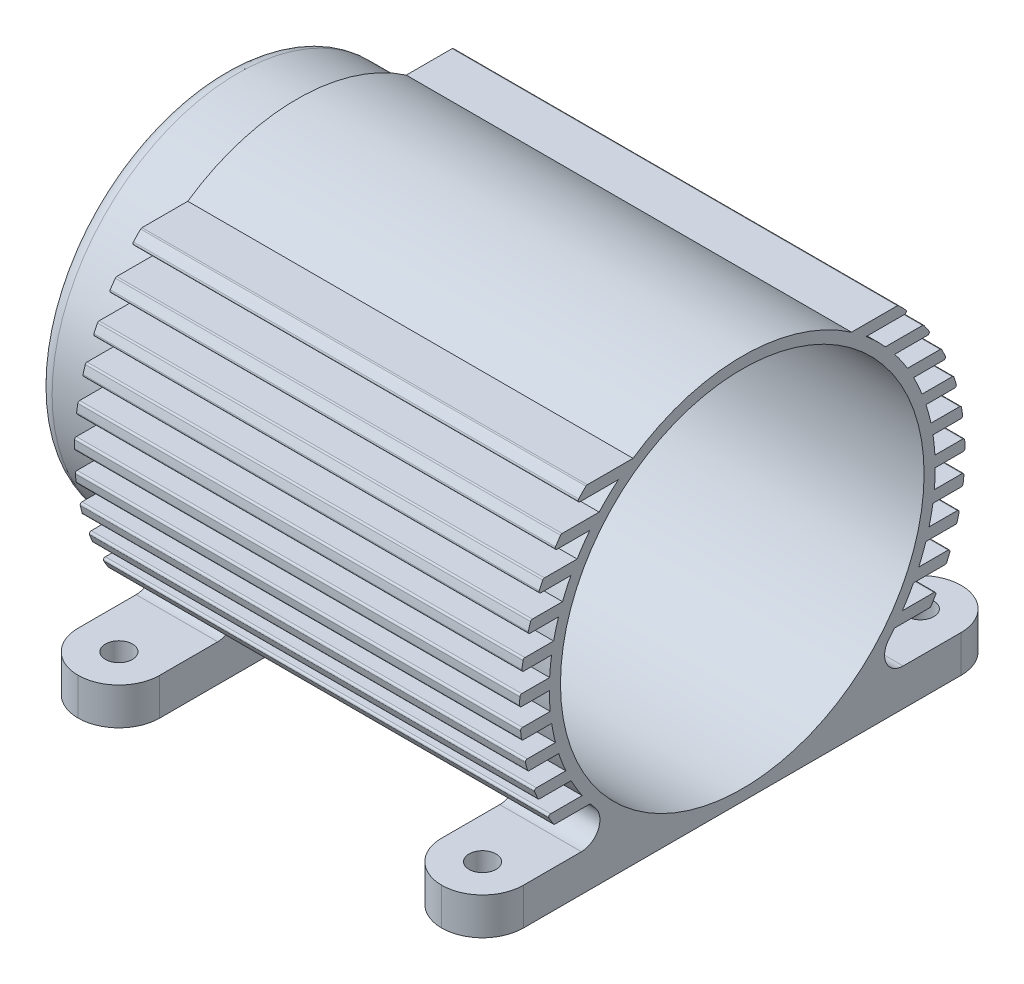
from build123d import *
from build123d.topology import SkipClean

# Parameters (mm, degrees)
BOSS_EXTRUDE1_START  = -558.8
BOSS_EXTRUDE1_DEPTH  = 558.8
FILLET1_R            = 279.4
SKETCH8_R            = 92.224359794
CUT_EXTRUDE1_DEPTH   = 558.8
FILLET1_OF_MIRROR1_R = 279.4
FILLET2_R            = 127
BOSS_EXTRUDE2_DEPTH  = 3048


with BuildPart() as part:
    # Sketch2 → Revolve1 (revolve)
    with BuildSketch(Plane.XY, mode=Mode.PRIVATE) as revolve1_sk:
        with BuildLine():
            Line((0, 393.7), (0, 1168.4))
            ThreePointArc((0, 1168.4), (29.757951031, 1240.242048969), (101.6, 1270))
            Line((101.6, 1270), (508, 1270))
            Line((508, 1270), (508, 1320.8))
            Line((508, 1320.8), (3556, 1320.8))
            Line((3556, 1320.8), (3556, 1244.6))
            Line((3556, 1244.6), (584.2, 1244.6))
            Line((584.2, 1244.6), (584.2, 1193.8))
            Line((584.2, 1193.8), (101.6, 1193.8))
            ThreePointArc((101.6, 1193.8), (83.639487758, 1186.360512242), (76.2, 1168.4))
            Line((76.2, 1168.4), (76.2, 393.7))
            Line((76.2, 393.7), (0, 393.7))
        make_face()
    revolve(revolve1_sk.sketch.rotate(Axis((0, 0, 0), (1, 0, 0)), 90), axis=Axis((0, 0, 0), (1, 0, 0)))

    # Sketch5 → Boss-Extrude1 (add)
    with SkipClean():  # the faces are left unmerged after this step: merging them gives an invalid solid
        with BuildSketch(Plane(origin=(3556, 0, 0), x_dir=(0, 0, -1), z_dir=(1, 0, 0)).offset(BOSS_EXTRUDE1_START)):
            with BuildLine():
                Line((-641.067016777, -1066.8), (-1778, -1066.8))
                Line((-1778, -1066.8), (-1778, -1320.8))
                Line((-1778, -1320.8), (1778, -1320.8))
                Line((1778, -1320.8), (1778, -1066.8))
                Line((1778, -1066.8), (641.067016777, -1066.8))
                ThreePointArc((641.067016777, -1066.8), (0, -1244.6), (-641.067016777, -1066.8))
            make_face()
        boss_extrude1 = extrude(amount=BOSS_EXTRUDE1_DEPTH)
    add(part.part.scale(1), mode=Mode.REPLACE)  # the faces are merged on a copy

    # Fillet1
    fillet1_edges = [part.edges().sort_by_distance(p)[0] for p in [
        (2997.2, -1193.8, 1778),
        (3556, -1193.8, 1778),
        (2997.2, -1193.8, -1778),
        (3556, -1193.8, -1778),
    ]]
    fillet(fillet1_edges, radius=FILLET1_R - 0.0001)  # a hair under: the kernel refuses the full size

    # Sketch8 → Cut-Extrude1 (cut)
    with BuildSketch(Plane(origin=(0, -1066.8, 0), x_dir=(1, 0, 0), z_dir=(0, 1, 0))):
        with Locations(Location((3276.6, -1498.6, 0), (0, 0, 270))):
            Circle(SKETCH8_R)
        with Locations(Location((3276.6, 1498.6, 0), (0, 0, 90))):
            Circle(SKETCH8_R)
    cut_extrude1 = extrude(amount=-CUT_EXTRUDE1_DEPTH, mode=Mode.SUBTRACT)

    # Mirror1: Boss-Extrude1, Cut-Extrude1 across plane
    add(boss_extrude1.mirror(Plane.ZY.offset(-2032)))
    add(cut_extrude1.mirror(Plane.ZY.offset(-2032)), mode=Mode.SUBTRACT)

    # Fillet1 of Mirror1
    fillet1_of_mirror1_edges = [part.edges().sort_by_distance(p)[0] for p in [
        (1066.8, -1193.8, 1778),
        (508, -1193.8, 1778),
        (1066.8, -1193.8, -1778),
        (508, -1193.8, -1778),
    ]]
    fillet(fillet1_of_mirror1_edges, radius=FILLET1_OF_MIRROR1_R - 0.0001)  # a hair under: the kernel refuses the full size

    # Fillet2
    fillet2_edges = [part.edges().sort_by_distance(p)[0] for p in [
        (3276.6, -1066.8, 778.749253611),
        (3276.6, -1066.8, -778.749253611),
        (787.4, -1066.8, -778.749253611),
        (787.4, -1066.8, 778.749253611),
    ]]
    fillet(fillet2_edges, radius=FILLET2_R)

    # Sketch9 → Boss-Extrude2 (add)
    with BuildSketch(Plane(origin=(3556, 0, 0), x_dir=(0, 0, -1), z_dir=(1, 0, 0))):
        with BuildLine():
            Line((1061.282386538, 1088.66811571), (747.873233801, 1088.66811571))
            ThreePointArc((747.873233801, 1088.66811571), (798.939026584, 1051.764741661), (848.186863062, 1012.46811571))
            Line((848.186863062, 1012.46811571), (1110.431458727, 1012.46811571))
            ThreePointArc((1110.431458727, 1012.46811571), (1122.065432641, 1020.074919173), (1119.762815523, 1033.782973825))
            ThreePointArc((1119.762815523, 1033.782973825), (1095.281300305, 1059.686214501), (1070.20072592, 1085.009864582))
            ThreePointArc((1070.20072592, 1085.009864582), (1066.102126641, 1087.718013809), (1061.282386538, 1088.66811571))
        make_face()
        with BuildLine():
            Line((1233.53895303, 885.860547298), (979.675319042, 885.860547298))
            ThreePointArc((979.675319042, 885.860547298), (1012.321699588, 848.361607184), (1043.533630579, 809.660547298))
            Line((1043.533630579, 809.660547298), (1267.971143302, 809.660547298))
            ThreePointArc((1267.971143302, 809.660547298), (1279.130321789, 816.297319156), (1278.626362994, 829.271140132))
            ThreePointArc((1278.626362994, 829.271140132), (1261.52564349, 855.060846265), (1243.904826585, 880.498030889))
            ThreePointArc((1243.904826585, 880.498030889), (1239.374360402, 884.440530489), (1233.53895303, 885.860547298))
        make_face()
        with BuildLine():
            Line((1354.494213239, 683.052978886), (1130.465067145, 683.052978886))
            ThreePointArc((1130.465067145, 683.052978886), (1152.429237397, 645.305735906), (1173.133454479, 606.852978886))
            Line((1173.133454479, 606.852978886), (1378.4708181, 606.852978886))
            ThreePointArc((1378.4708181, 606.852978886), (1389.134081201, 612.654803762), (1390.054606488, 624.759306439))
            ThreePointArc((1390.054606488, 624.759306439), (1378.203591164, 650.485096911), (1365.876517552, 675.986197196))
            ThreePointArc((1365.876517552, 675.986197196), (1361.19302386, 681.142600578), (1354.494213239, 683.052978886))
        make_face()
        with BuildLine():
            Line((1437.160039503, 480.245410473), (1230.39708457, 480.245410473))
            ThreePointArc((1230.39708457, 480.245410473), (1244.522672917, 442.352751315), (1257.481588841, 404.045410473))
            Line((1257.481588841, 404.045410473), (1452.704702563, 404.045410473))
            ThreePointArc((1452.704702563, 404.045410473), (1462.847833019, 409.102969465), (1464.912305106, 420.247472746))
            ThreePointArc((1464.912305106, 420.247472746), (1457.299767723, 445.929800522), (1449.237014625, 471.474363503))
            ThreePointArc((1449.237014625, 471.474363503), (1444.623024715, 477.821297381), (1437.160039503, 480.245410473))
        make_face()
        with BuildLine():
            Line((1487.931975925, 277.437842061), (1291.332987185, 277.437842061))
            ThreePointArc((1291.332987185, 277.437842061), (1298.915205213, 239.44086883), (1305.379627129, 201.237842061))
            Line((1305.379627129, 201.237842061), (1496.080976998, 201.237842061))
            ThreePointArc((1496.080976998, 201.237842061), (1505.67581993, 205.617446091), (1508.653086048, 215.735639053))
            ThreePointArc((1508.653086048, 215.735639053), (1504.762352566, 241.384055606), (1500.435605975, 266.96252981))
            ThreePointArc((1500.435605975, 266.96252981), (1496.087846988, 274.47292127), (1487.931975925, 277.437842061))
        make_face()
        with BuildLine():
            Line((1510.030572937, 74.630273649), (1318.689865835, 74.630273649))
            ThreePointArc((1318.689865835, 74.630273649), (1320.294310722, 36.545493231), (1320.799067216, -1.569726351))
            Line((1320.799067216, -1.569726351), (1511.259013872, -1.569726351))
            ThreePointArc((1511.259013872, -1.569726351), (1520.272277785, 2.183147092), (1523.95866945, 11.22380536))
            ThreePointArc((1523.95866945, 11.22380536), (1523.554604641, 36.842457519), (1522.719905483, 62.450696117))
            ThreePointArc((1522.719905483, 62.450696117), (1518.824907326, 71.092679592), (1510.030572937, 74.630273649))
        make_face()
        with BuildLine():
            Line((1504.71966752, -128.177294763), (1314.565791852, -128.177294763))
            ThreePointArc((1314.565791852, -128.177294763), (1310.282833829, -166.347634107), (1304.891781484, -204.377294763))
            Line((1304.891781484, -204.377294763), (1499.095562222, -204.377294763))
            ThreePointArc((1499.095562222, -204.377294763), (1507.487036576, -201.210036141), (1511.693003921, -193.288028333))
            ThreePointArc((1511.693003921, -193.288028333), (1514.745256844, -167.698559532), (1517.364370608, -142.061137576))
            ThreePointArc((1517.364370608, -142.061137576), (1514.109151098, -132.325827162), (1504.71966752, -128.177294763))
        make_face()
        with BuildLine():
            Line((1471.702553108, -330.984863176), (1278.656193177, -330.984863176))
            ThreePointArc((1278.656193177, -330.984863176), (1268.134823471, -369.251553145), (1256.46851421, -407.184863176))
            Line((1256.46851421, -407.184863176), (1458.90691366, -407.184863176))
            ThreePointArc((1458.90691366, -407.184863176), (1466.62667773, -404.569269093), (1471.166635624, -397.799862026))
            ThreePointArc((1471.166635624, -397.799862026), (1477.84019716, -372.242329215), (1484.069801453, -346.572971269))
            ThreePointArc((1484.069801453, -346.572971269), (1481.65164786, -335.791479009), (1471.702553108, -330.984863176))
        make_face()
        with BuildLine():
            Line((1409.032899622, -533.792431588), (1208.13007577, -533.792431588))
            ThreePointArc((1208.13007577, -533.792431588), (1190.426949166, -572.185563169), (1171.504107294, -609.992431588))
            Line((1171.504107294, -609.992431588), (1388.261301473, -609.992431588))
            ThreePointArc((1388.261301473, -609.992431588), (1395.245044937, -607.899850088), (1399.92736283, -602.311695719))
            ThreePointArc((1399.92736283, -602.311695719), (1410.632993645, -576.793340148), (1420.873512224, -551.084804962))
            ThreePointArc((1420.873512224, -551.084804962), (1419.511762677, -539.317236185), (1409.032899622, -533.792431588))
        make_face()
        with BuildLine():
            Line((1312.469885369, -736.6), (1096.327086229, -736.6))
            ThreePointArc((1096.327086229, -736.6), (1069.387568443, -775.19214938), (1041.090197821, -812.8))
            Line((1041.090197821, -812.8), (1282.134033555, -812.8))
            ThreePointArc((1282.134033555, -812.8), (1288.294438431, -811.205827829), (1292.908269131, -806.823529412))
            ThreePointArc((1292.908269131, -806.823529412), (1308.454376632, -781.359804619), (1323.499044069, -755.596638655))
            ThreePointArc((1323.499044069, -755.596638655), (1323.452993101, -742.923375145), (1312.469885369, -736.6))
        make_face()
        with BuildLine():
            Line((-1096.327086229, -736.6), (-1312.469885369, -736.6))
            ThreePointArc((-1312.469885369, -736.6), (-1323.452993101, -742.923375145), (-1323.499044069, -755.596638655))
            ThreePointArc((-1323.499044069, -755.596638655), (-1308.454376632, -781.359804619), (-1292.908269131, -806.823529412))
            ThreePointArc((-1292.908269131, -806.823529412), (-1288.294438431, -811.205827829), (-1282.134033555, -812.8))
            Line((-1282.134033555, -812.8), (-1041.090197821, -812.8))
            ThreePointArc((-1041.090197821, -812.8), (-1069.387568443, -775.19214938), (-1096.327086229, -736.6))
        make_face()
        with BuildLine():
            Line((-1388.261301473, -609.992431588), (-1171.504107294, -609.992431588))
            ThreePointArc((-1171.504107294, -609.992431588), (-1190.426949166, -572.185563169), (-1208.13007577, -533.792431588))
            Line((-1208.13007577, -533.792431588), (-1409.032899622, -533.792431588))
            ThreePointArc((-1409.032899622, -533.792431588), (-1419.511762677, -539.317236185), (-1420.873512224, -551.084804962))
            ThreePointArc((-1420.873512224, -551.084804962), (-1410.632993645, -576.793340148), (-1399.92736283, -602.311695719))
            ThreePointArc((-1399.92736283, -602.311695719), (-1395.245044937, -607.899850088), (-1388.261301473, -609.992431588))
        make_face()
        with BuildLine():
            Line((-1458.90691366, -407.184863176), (-1256.46851421, -407.184863176))
            ThreePointArc((-1256.46851421, -407.184863176), (-1268.134823471, -369.251553145), (-1278.656193177, -330.984863176))
            Line((-1278.656193177, -330.984863176), (-1471.702553108, -330.984863176))
            ThreePointArc((-1471.702553108, -330.984863176), (-1481.65164786, -335.791479009), (-1484.069801453, -346.572971269))
            ThreePointArc((-1484.069801453, -346.572971269), (-1477.84019716, -372.242329215), (-1471.166635624, -397.799862026))
            ThreePointArc((-1471.166635624, -397.799862026), (-1466.62667773, -404.569269093), (-1458.90691366, -407.184863176))
        make_face()
        with BuildLine():
            Line((-1499.095562222, -204.377294763), (-1304.891781484, -204.377294763))
            ThreePointArc((-1304.891781484, -204.377294763), (-1310.282833829, -166.347634107), (-1314.565791852, -128.177294763))
            Line((-1314.565791852, -128.177294763), (-1504.71966752, -128.177294763))
            ThreePointArc((-1504.71966752, -128.177294763), (-1514.109151098, -132.325827162), (-1517.364370608, -142.061137576))
            ThreePointArc((-1517.364370608, -142.061137576), (-1514.745256844, -167.698559532), (-1511.693003921, -193.288028333))
            ThreePointArc((-1511.693003921, -193.288028333), (-1507.487036576, -201.210036141), (-1499.095562222, -204.377294763))
        make_face()
        with BuildLine():
            Line((-1511.259013872, -1.569726351), (-1320.799067216, -1.569726351))
            ThreePointArc((-1320.799067216, -1.569726351), (-1320.294310722, 36.545493231), (-1318.689865835, 74.630273649))
            Line((-1318.689865835, 74.630273649), (-1510.030572937, 74.630273649))
            ThreePointArc((-1510.030572937, 74.630273649), (-1518.824907326, 71.092679592), (-1522.719905483, 62.450696117))
            ThreePointArc((-1522.719905483, 62.450696117), (-1523.554604641, 36.842457519), (-1523.95866945, 11.22380536))
            ThreePointArc((-1523.95866945, 11.22380536), (-1520.272277785, 2.183147092), (-1511.259013872, -1.569726351))
        make_face()
        with BuildLine():
            Line((-1496.080976998, 201.237842061), (-1305.379627129, 201.237842061))
            ThreePointArc((-1305.379627129, 201.237842061), (-1298.915205213, 239.44086883), (-1291.332987185, 277.437842061))
            Line((-1291.332987185, 277.437842061), (-1487.931975925, 277.437842061))
            ThreePointArc((-1487.931975925, 277.437842061), (-1496.087846988, 274.47292127), (-1500.435605975, 266.96252981))
            ThreePointArc((-1500.435605975, 266.96252981), (-1504.762352566, 241.384055606), (-1508.653086048, 215.735639053))
            ThreePointArc((-1508.653086048, 215.735639053), (-1505.67581993, 205.617446091), (-1496.080976998, 201.237842061))
        make_face()
        with BuildLine():
            Line((-1452.704702563, 404.045410473), (-1257.481588841, 404.045410473))
            ThreePointArc((-1257.481588841, 404.045410473), (-1244.522672917, 442.352751315), (-1230.39708457, 480.245410473))
            Line((-1230.39708457, 480.245410473), (-1437.160039503, 480.245410473))
            ThreePointArc((-1437.160039503, 480.245410473), (-1444.623024715, 477.821297381), (-1449.237014625, 471.474363503))
            ThreePointArc((-1449.237014625, 471.474363503), (-1457.299767723, 445.929800522), (-1464.912305106, 420.247472746))
            ThreePointArc((-1464.912305106, 420.247472746), (-1462.847833019, 409.102969465), (-1452.704702563, 404.045410473))
        make_face()
        with BuildLine():
            Line((-1378.4708181, 606.852978886), (-1173.133454479, 606.852978886))
            ThreePointArc((-1173.133454479, 606.852978886), (-1152.429237397, 645.305735906), (-1130.465067145, 683.052978886))
            Line((-1130.465067145, 683.052978886), (-1354.494213239, 683.052978886))
            ThreePointArc((-1354.494213239, 683.052978886), (-1361.19302386, 681.142600578), (-1365.876517552, 675.986197196))
            ThreePointArc((-1365.876517552, 675.986197196), (-1378.203591164, 650.485096911), (-1390.054606488, 624.759306439))
            ThreePointArc((-1390.054606488, 624.759306439), (-1389.134081201, 612.654803762), (-1378.4708181, 606.852978886))
        make_face()
        with BuildLine():
            Line((-1267.971143302, 809.660547298), (-1043.533630579, 809.660547298))
            ThreePointArc((-1043.533630579, 809.660547298), (-1012.321699588, 848.361607184), (-979.675319042, 885.860547298))
            Line((-979.675319042, 885.860547298), (-1233.53895303, 885.860547298))
            ThreePointArc((-1233.53895303, 885.860547298), (-1239.374360402, 884.440530489), (-1243.904826585, 880.498030889))
            ThreePointArc((-1243.904826585, 880.498030889), (-1261.52564349, 855.060846265), (-1278.626362994, 829.271140132))
            ThreePointArc((-1278.626362994, 829.271140132), (-1279.130321789, 816.297319156), (-1267.971143302, 809.660547298))
        make_face()
        with BuildLine():
            Line((-1110.431458727, 1012.46811571), (-848.186863062, 1012.46811571))
            ThreePointArc((-848.186863062, 1012.46811571), (-798.939026584, 1051.764741661), (-747.873233801, 1088.66811571))
            Line((-747.873233801, 1088.66811571), (-1061.282386538, 1088.66811571))
            ThreePointArc((-1061.282386538, 1088.66811571), (-1066.102126641, 1087.718013809), (-1070.20072592, 1085.009864582))
            ThreePointArc((-1070.20072592, 1085.009864582), (-1095.281300305, 1059.686214501), (-1119.762815523, 1033.782973825))
            ThreePointArc((-1119.762815523, 1033.782973825), (-1122.065432641, 1020.074919173), (-1110.431458727, 1012.46811571))
        make_face()
    extrude(amount=-BOSS_EXTRUDE2_DEPTH)


solid = part.part
